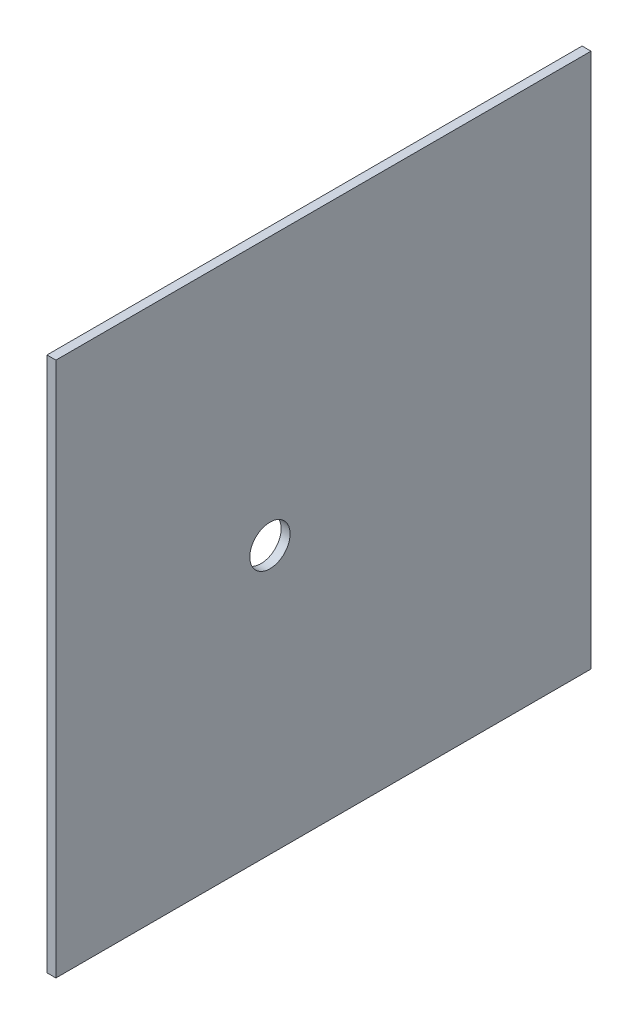
from build123d import *

# Parameters (mm, degrees)
SKETCH1_W           = 381
SKETCH1_H           = 381
SKETCH1_R           = 14.351
BOSS_EXTRUDE1_DEPTH = 6.35


with BuildPart() as part:
    # Sketch1 → Boss-Extrude1 (new body)
    with BuildSketch(Plane(origin=(0, 0, 0), x_dir=(0, 0, -1), z_dir=(1, 0, 0))):
        Rectangle(SKETCH1_W, SKETCH1_H)
        with Locations((-38.1, 0)):
            Circle(SKETCH1_R, mode=Mode.SUBTRACT)
    extrude(amount=BOSS_EXTRUDE1_DEPTH)


solid = part.part
